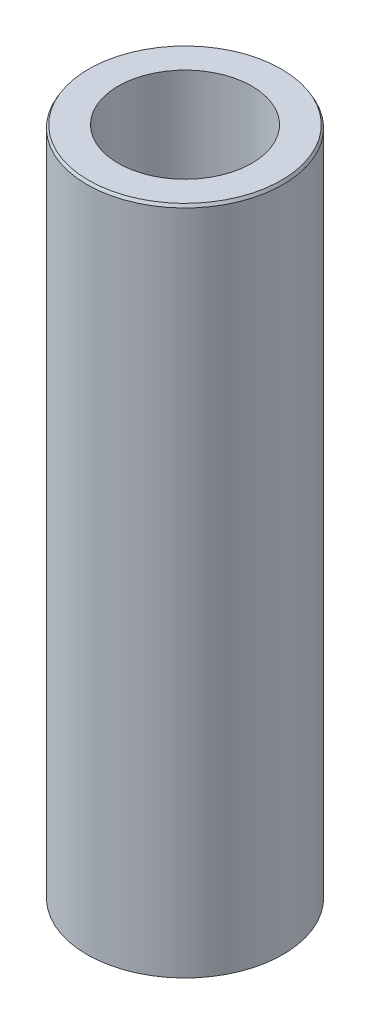
from build123d import *
from OCP.BRepFilletAPI import BRepFilletAPI_MakeChamfer

# Parameters (mm, degrees)
SKETCH1_R           = 35
BOSS_EXTRUDE1_DEPTH = 239.682260128
SKETCH2_R           = 23.877096469
CUT_EXTRUDE1_DEPTH  = 245.739832924
CHAMFER1_SIZE       = 1.014471228
CHAMFER1_SIZE2      = 0.585705236


with BuildPart() as part:
    # Sketch1 → Boss-Extrude1 (new body)
    with BuildSketch(Plane(origin=(0, 0, 0), x_dir=(1, 0, 0), z_dir=(0, 1, 0))):
        Circle(SKETCH1_R)
    extrude(amount=BOSS_EXTRUDE1_DEPTH)

    # Sketch2 → Cut-Extrude1 (cut, through all)
    with BuildSketch(Plane(origin=(0, 0, 0), x_dir=(1, 0, 0), z_dir=(0, 1, 0))):
        Circle(SKETCH2_R)
    extrude(amount=CUT_EXTRUDE1_DEPTH, mode=Mode.SUBTRACT)

    # Chamfer1: one chamfer whose edges measure the first distance from different faces: ONE call of the kernel's chamfer builder (chamfer() names one face for all edges)
    chamfer1_edges_1 = [part.edges().sort_by_distance(p)[0] for p in [
        (-35, 239.682260128, 0),
    ]]
    chamfer1_side_1 = [part.faces().sort_by_distance(p)[0] for p in [
        (-35, 119.841130064, 0),
    ]]
    chamfer1_edges_2 = [part.edges().sort_by_distance(p)[0] for p in [
        (-35, 0, 0),
    ]]
    chamfer1_side_2 = [part.faces().sort_by_distance(p)[0] for p in [
        (-34.010050506, 0, 0),
    ]]
    chamfer1 = BRepFilletAPI_MakeChamfer(part.part.solid().wrapped)
    for e in chamfer1_edges_1:
        chamfer1.Add(CHAMFER1_SIZE, CHAMFER1_SIZE2, e.wrapped, chamfer1_side_1[0].wrapped)  # the first distance lies on this face
    for e in chamfer1_edges_2:
        chamfer1.Add(CHAMFER1_SIZE, CHAMFER1_SIZE2, e.wrapped, chamfer1_side_2[0].wrapped)  # the first distance lies on this face
    add(Compound.cast(chamfer1.Shape()), mode=Mode.REPLACE)


solid = part.part
